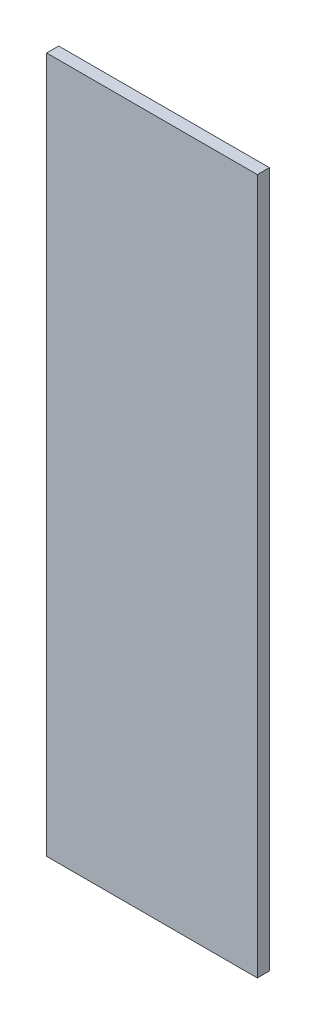
from build123d import *

# Parameters (mm, degrees)
SKETCH1_W           = 28
SKETCH1_H           = 92.46
BOSS_EXTRUDE1_DEPTH = 1.6


with BuildPart() as part:
    # Sketch1 → Boss-Extrude1 (new body)
    with BuildSketch(Plane.XY):
        with Locations((0, 46.23)):
            Rectangle(SKETCH1_W, SKETCH1_H)
    extrude(amount=BOSS_EXTRUDE1_DEPTH)


solid = part.part
